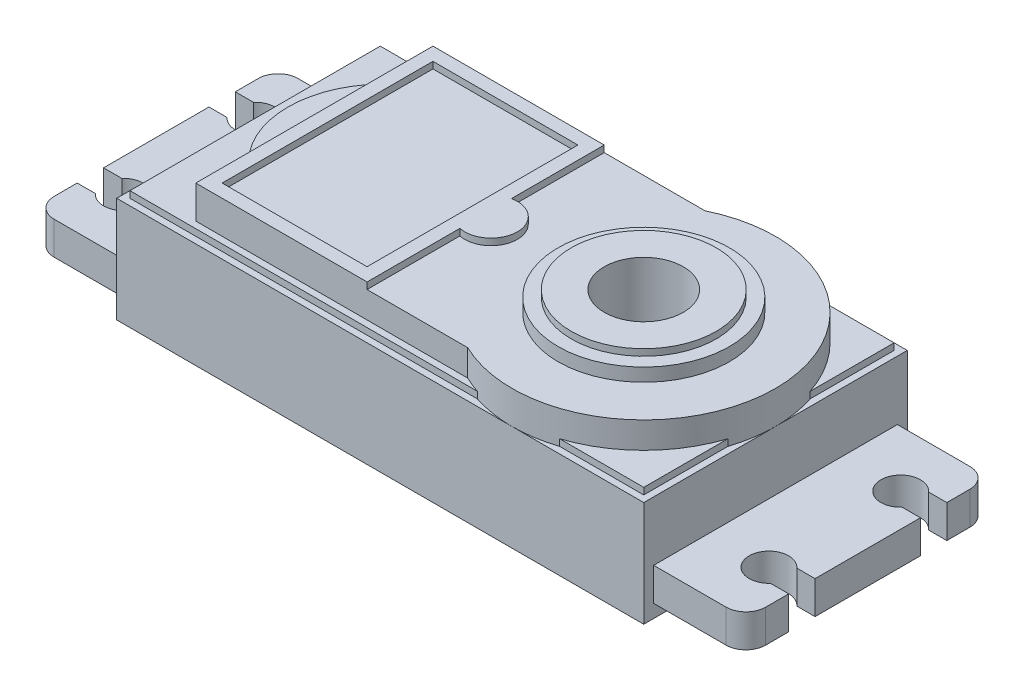
from build123d import *

# Parameters (mm, degrees)
SCHIZZO1_W                   = 40
SCHIZZO1_H                   = 20
ESTRUSIONE_ESTRUSIONE2_DEPTH = 8
TAGLIO_ESTRUSIONE4_DEPTH     = 6
ESTRUSIONE_ESTRUSIONE4_DEPTH = 2.5
SCHIZZO7_W                   = 39
SCHIZZO7_H                   = 19
ESTRUSIONE_ESTRUSIONE3_DEPTH = 0.5
SCHIZZO8_W                   = 11
SCHIZZO8_H                   = 16
ESTRUSIONE_ESTRUSIONE5_DEPTH = 0.5
SCHIZZO9_R                   = 6.5
ESTRUSIONE_ESTRUSIONE6_DEPTH = 1
SCHIZZO10_R                  = 5.5
ESTRUSIONE_ESTRUSIONE7_DEPTH = 0.5
SCHIZZO11_R                  = 3
TAGLIO_ESTRUSIONE5_DEPTH     = 26.377155081
SCHIZZO12_R                  = 1.5
ESTRUSIONE_ESTRUSIONE8_DEPTH = 2.5
TAGLIO_ESTRUSIONE6_DEPTH     = 31.020826105
SPECCHIA4_COPY_1_DEPTH       = 31.020826105


with BuildPart() as part:
    # Schizzo1 → Estrusione-Estrusione2 (new body)
    with BuildSketch(Plane(origin=(0, 0, 0), x_dir=(1, 0, 0), z_dir=(0, 1, 0))):
        Rectangle(SCHIZZO1_W, SCHIZZO1_H)
    extrude(amount=ESTRUSIONE_ESTRUSIONE2_DEPTH)

    # Schizzo2 → Taglio-Estrusione4 (cut)
    with BuildSketch(Plane(origin=(0, 0, 0), x_dir=(1, 0, 0), z_dir=(0, 1, 0))):
        Polygon((16, -8), (-16, -8), (-16, -6), (-18, -6), (-18, 6), (-16, 6), (-16, 8), (16, 8), (16, 6), (18, 6), (18, -6), (16, -6), align=None)
    extrude(amount=TAGLIO_ESTRUSIONE4_DEPTH, mode=Mode.SUBTRACT)

    # Schizzo3 → Foro per Vite M1-1 (revolve, cut)
    with BuildSketch(Plane(origin=(-18, 0, 8), x_dir=(0, 0, -1), z_dir=(1, 0, 0))):
        Polygon((0, 0), (0, 5.390559402), (0.65, 5), (0.65, 0.025), (0.675, 0), align=None)
    foro_per_vite_m1_1 = revolve(axis=Axis((-18, -6.35, 8), (0, 1, 0)), mode=Mode.SUBTRACT)

    # Specchia1: Foro per Vite M1-1 across plane
    add(foro_per_vite_m1_1.mirror(Plane(origin=(0, 0, 0), x_dir=(0, 0, 1), z_dir=(1, 0, 0))), mode=Mode.SUBTRACT)

    # Specchia2 copy 1 sketch → Specchia2 copy 1 (revolve, cut)
    with BuildSketch(Plane(origin=(18, 0, -8), x_dir=(0, 0, 1), z_dir=(-1, 0, 0))):
        Polygon((0, 0), (0, 5.390559402), (0.65, 5), (0.65, 0.025), (0.675, 0), align=None)
    revolve(axis=Axis((18, -6.35, -8), (0, 1, 0)), mode=Mode.SUBTRACT)

    # Specchia2 copy 2 sketch → Specchia2 copy 2 (revolve, cut)
    with BuildSketch(Plane(origin=(-18, 0, -8), x_dir=(0, 0, 1), z_dir=(1, 0, 0))):
        Polygon((0, 0), (0, -5.390559402), (0.65, -5), (0.65, -0.025), (0.675, 0), align=None)
    revolve(axis=Axis((-18, -6.35, -8), (0, -1, 0)), mode=Mode.SUBTRACT)

    # Taglia-Sweep3: sweep along a path in Schizzo5
    with BuildLine(Plane.XZ) as taglia_sweep3_path:
        Line((19, -9), (-19, -9))
        Line((-19, -9), (-19, 9))
        Line((-19, 9), (19, 9))
        Line((19, 9), (19, -9))
    # Schizzo4 → Taglia-Sweep3 (sweep, cut)
    with BuildSketch(Plane.XY):
        with BuildLine():
            Line((-19.25, 0), (-18.75, 0))
            ThreePointArc((-18.75, 0), (-19, 0.25), (-19.25, 0))
        make_face()
    sweep(path=taglia_sweep3_path.line, transition=Transition.RIGHT, mode=Mode.SUBTRACT)

    # Schizzo6 → Estrusione-Estrusione4 (add)
    with BuildSketch(Plane(origin=(0, 8, 0), x_dir=(1, 0, 0), z_dir=(0, 1, 0))):
        with BuildLine():
            Line((5.641101056, 9), (-15, 9))
            Line((-15, 9), (-15, 5))
            ThreePointArc((-15, 5), (-17, 0), (-15, -5))
            Line((-15, -5), (-15, -9))
            Line((-15, -9), (5.641101056, -9))
            ThreePointArc((5.641101056, -9), (20, 0), (5.641101056, 9))
        make_face()
    extrude(amount=ESTRUSIONE_ESTRUSIONE4_DEPTH)

    # Schizzo7 → Estrusione-Estrusione3 (add)
    with BuildSketch(Plane(origin=(0, 8, 0), x_dir=(1, 0, 0), z_dir=(0, 1, 0))):
        Rectangle(SCHIZZO7_W, SCHIZZO7_H)
    extrude(amount=ESTRUSIONE_ESTRUSIONE3_DEPTH)

    # Schizzo8 → Estrusione-Estrusione5 (add)
    with BuildSketch(Plane(origin=(0, 10.5, 0), x_dir=(1, 0, 0), z_dir=(0, 1, 0))):
        with BuildLine():
            Line((-15, 9), (-2, 9))
            Line((-2, 9), (-2, 1.957707578))
            ThreePointArc((-2, 1.957707578), (0.409122281, 0), (-2, -1.957707578))
            Line((-2, -1.957707578), (-2, -9))
            Line((-2, -9), (-15, -9))
            Line((-15, -9), (-15, 9))
        make_face()
        with Locations((-8.5, 0)):
            Rectangle(SCHIZZO8_W, SCHIZZO8_H, mode=Mode.SUBTRACT)
    extrude(amount=ESTRUSIONE_ESTRUSIONE5_DEPTH)

    # Schizzo9 → Estrusione-Estrusione6 (add)
    with BuildSketch(Plane(origin=(0, 10.5, 0), x_dir=(1, 0, 0), z_dir=(0, 1, 0))):
        with Locations((10, 0)):
            Circle(SCHIZZO9_R)
    extrude(amount=ESTRUSIONE_ESTRUSIONE6_DEPTH)

    # Schizzo10 → Estrusione-Estrusione7 (add)
    with BuildSketch(Plane(origin=(0, 11.5, 0), x_dir=(1, 0, 0), z_dir=(0, 1, 0))):
        with Locations((10, 0)):
            Circle(SCHIZZO10_R)
    extrude(amount=ESTRUSIONE_ESTRUSIONE7_DEPTH)

    # Schizzo11 → Taglio-Estrusione5 (cut, through all)
    with BuildSketch(Plane(origin=(0, 12, 0), x_dir=(1, 0, 0), z_dir=(0, 1, 0))):
        with Locations((10, 0)):
            Circle(SCHIZZO11_R)
    extrude(amount=-TAGLIO_ESTRUSIONE5_DEPTH, mode=Mode.SUBTRACT)

    # Schizzo12 → Estrusione-Estrusione8 (add)
    with BuildSketch(Plane(origin=(0, 1, 0), x_dir=(-1, 0, 0), z_dir=(0, -1, 0))):
        with BuildLine():
            Line((-25.5, 9.25), (-20, 9.25))
            Line((-20, 9.25), (-20, -9.25))
            Line((-20, -9.25), (-25.5, -9.25))
            ThreePointArc((-25.5, -9.25), (-26.560660172, -8.810660172), (-27, -7.75))
            Line((-27, -7.75), (-27, 7.75))
            ThreePointArc((-27, 7.75), (-26.560660172, 8.810660172), (-25.5, 9.25))
        make_face()
        with Locations((-24.5, 5)):
            Circle(SCHIZZO12_R, mode=Mode.SUBTRACT)
        with Locations((-24.5, -5)):
            Circle(SCHIZZO12_R, mode=Mode.SUBTRACT)
    estrusione_estrusione8 = extrude(amount=-ESTRUSIONE_ESTRUSIONE8_DEPTH)

    # Schizzo13 → Taglio-Estrusione6 (cut, through all)
    with BuildSketch(Plane(origin=(0, 3.5, 0), x_dir=(1, 0, 0), z_dir=(0, 1, 0))):
        with BuildLine():
            Line((25.618033989, 4), (34.322091749, 4))
            Line((34.322091749, 4), (34.322091749, 6))
            Line((34.322091749, 6), (25.618033989, 6))
            ThreePointArc((25.618033989, 6), (26, 5), (25.618033989, 4))
        make_face()
    taglio_estrusione6 = extrude(amount=-TAGLIO_ESTRUSIONE6_DEPTH, mode=Mode.SUBTRACT)

    # Specchia3: Taglio-Estrusione6 across plane
    add(taglio_estrusione6.mirror(Plane.XY), mode=Mode.SUBTRACT)

    # Specchia4: Estrusione-Estrusione8, Taglio-Estrusione6 across plane
    add(estrusione_estrusione8.mirror(Plane(origin=(0, 0, 0), x_dir=(0, 0, 1), z_dir=(1, 0, 0))))
    add(taglio_estrusione6.mirror(Plane(origin=(0, 0, 0), x_dir=(0, 0, 1), z_dir=(1, 0, 0))), mode=Mode.SUBTRACT)

    # Specchia4 copy 1 sketch → Specchia4 copy 1 (cut, through all)
    with BuildSketch(Plane(origin=(0, 3.5, 0), x_dir=(-1, 0, 0), z_dir=(0, 1, 0))):
        with BuildLine():
            Line((25.618033989, 4), (34.322091749, 4))
            Line((34.322091749, 4), (34.322091749, 6))
            Line((34.322091749, 6), (25.618033989, 6))
            ThreePointArc((25.618033989, 6), (26, 5), (25.618033989, 4))
        make_face()
    extrude(amount=-SPECCHIA4_COPY_1_DEPTH, mode=Mode.SUBTRACT)


solid = part.part
